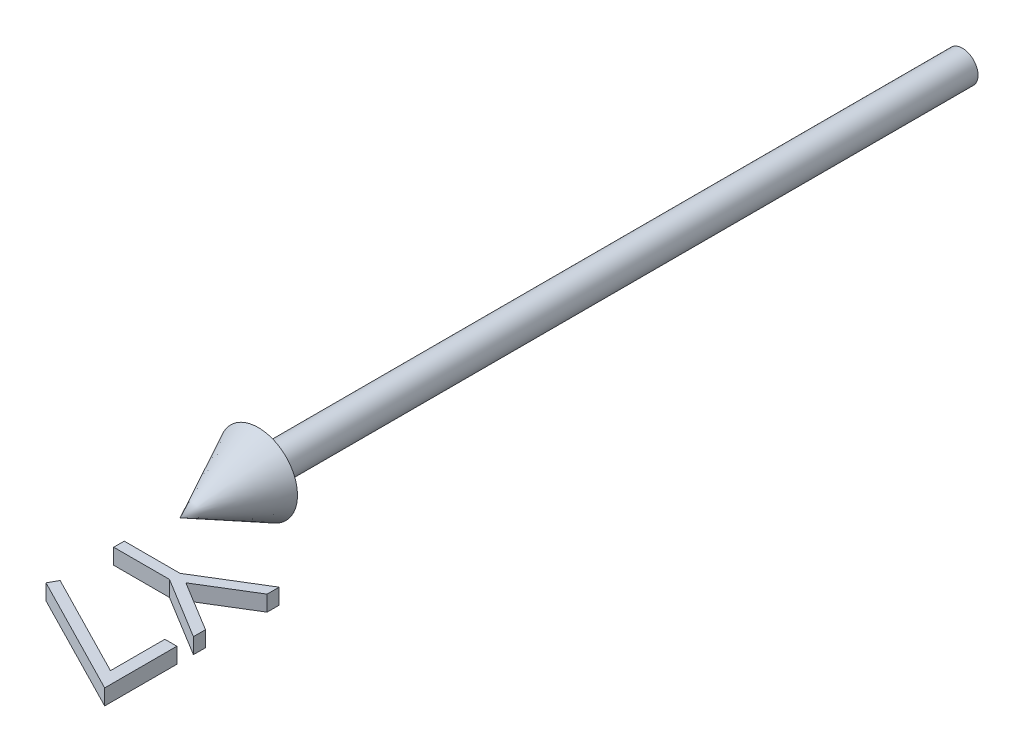
from build123d import *

# Parameters (mm, degrees)
BOSS_EXTRUDE1_DEPTH        = 1
BOSS_EXTRUDE1_DEPTH_BACK   = 1
BOSS_EXTRUDE1_2_DEPTH      = 1
BOSS_EXTRUDE1_2_DEPTH_BACK = 1


with BuildPart() as part:
    # Sketch2 → Revolve1 (revolve)
    with BuildSketch(Plane(origin=(0, 0, 0), x_dir=(1, 0, 0), z_dir=(0, 1, 0))):
        Polygon((0, -100), (5, -90), (2, -90), (2, 0), (0, 0), align=None)
    revolve(axis=Axis((0, 0, -41.949952025), (0, 0, 1)))


with BuildPart() as body_2:
    # Sketch3 → Boss-Extrude1 (new, two sides: drawn at the far end of the back side and taken through both)
    with BuildSketch(Plane(origin=(0, 0, 0), x_dir=(1, 0, 0), z_dir=(0, 1, 0)).offset(-BOSS_EXTRUDE1_DEPTH_BACK)):
        Polygon((15, -102.339799406), (15, -103.881265752), (8.5546875, -107.823573444), (15, -111.759871521), (15, -113.301337867), (7.130408654, -108.49364556), (0, -108.49364556), (0, -107.147491713), (7.130408654, -107.147491713), align=None)
    extrude(amount=BOSS_EXTRUDE1_DEPTH + BOSS_EXTRUDE1_DEPTH_BACK)


with BuildPart() as body_3:
    # Sketch3 → Boss-Extrude1 2 (new, two sides: drawn at the far end of the back side and taken through both)
    with BuildSketch(Plane(origin=(0, 0, 0), x_dir=(1, 0, 0), z_dir=(0, 1, 0)).offset(-BOSS_EXTRUDE1_2_DEPTH_BACK)):
        Polygon((15, -115.416722483), (15, -124.647491713), (-0.384615385, -116.762876329), (0.255408654, -115.600015752), (13.461538462, -122.369847483), (13.461538462, -115.416722483), align=None)
    extrude(amount=BOSS_EXTRUDE1_2_DEPTH + BOSS_EXTRUDE1_2_DEPTH_BACK)


solid = Compound([part.part, body_2.part, body_3.part])
